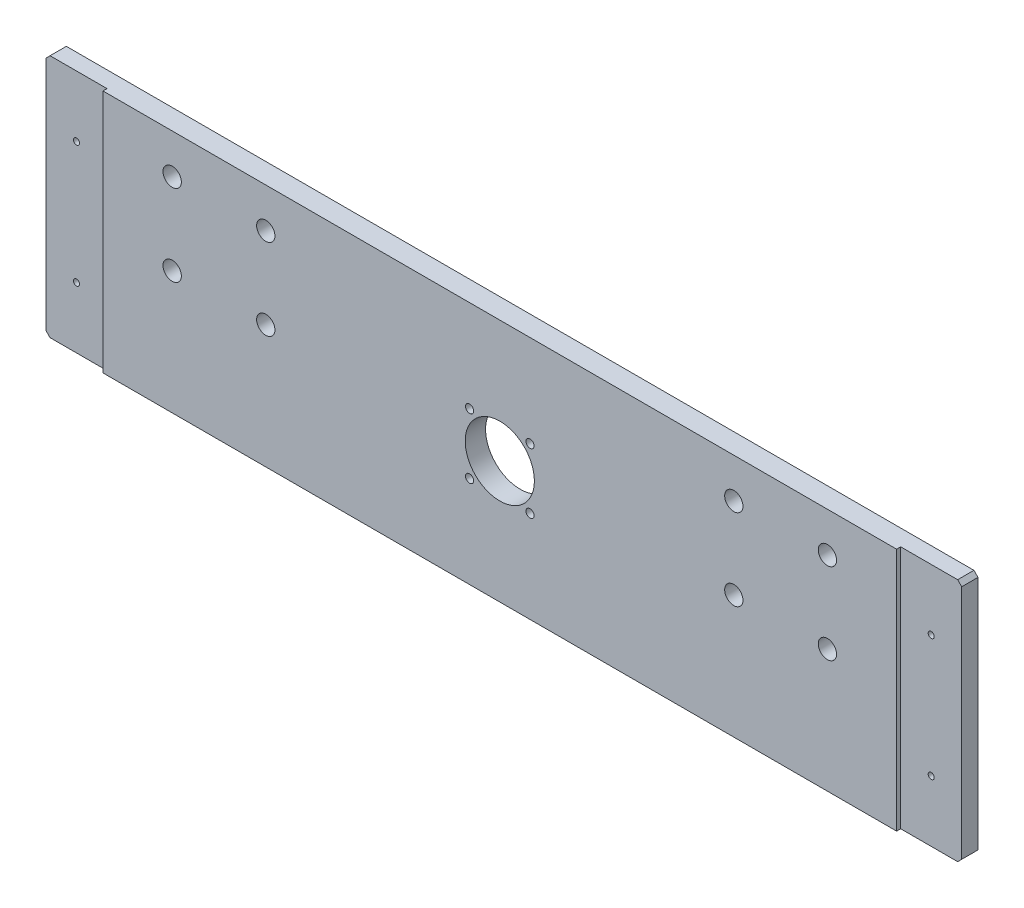
from build123d import *

# Parameters (mm, degrees)
SCHIZZO1_R                   = 17
SCHIZZO1_R_2                 = 2
SCHIZZO1_R_3                 = 4.5
SCHIZZO1_R_4                 = 1.5
ESTRUSIONE_ESTRUSIONE1_DEPTH = 10
SCHIZZO2_W                   = 30
SCHIZZO2_H                   = 120
TAGLIO_ESTRUSIONE1_DEPTH     = 2


with BuildPart() as part:
    # Schizzo1 → Estrusione-Estrusione1 (new body)
    with BuildSketch(Plane.XY):
        Polygon((2, 0), (448, 0), (450, 2), (450, 118), (448, 120), (2, 120), (0, 118), (0, 2), align=None)
        with Locations((225, 60)):
            Circle(SCHIZZO1_R, mode=Mode.SUBTRACT)
        with Locations((239.849242405, 74.849242405)):
            Circle(SCHIZZO1_R_2, mode=Mode.SUBTRACT)
        with Locations((386, 100.5)):
            Circle(SCHIZZO1_R_3, mode=Mode.SUBTRACT)
        with Locations((239.849242405, 45.150757595)):
            Circle(SCHIZZO1_R_2, mode=Mode.SUBTRACT)
        with Locations((210.150757595, 45.150757595)):
            Circle(SCHIZZO1_R_2, mode=Mode.SUBTRACT)
        with Locations((110, 100.5)):
            Circle(SCHIZZO1_R_3, mode=Mode.SUBTRACT)
        with Locations((110, 60.5)):
            Circle(SCHIZZO1_R_3, mode=Mode.SUBTRACT)
        with Locations((64, 60.5)):
            Circle(SCHIZZO1_R_3, mode=Mode.SUBTRACT)
        with Locations((64, 100.5)):
            Circle(SCHIZZO1_R_3, mode=Mode.SUBTRACT)
        with Locations((386, 60.5)):
            Circle(SCHIZZO1_R_3, mode=Mode.SUBTRACT)
        with Locations((15, 30)):
            Circle(SCHIZZO1_R_4, mode=Mode.SUBTRACT)
        with Locations((435, 30)):
            Circle(SCHIZZO1_R_4, mode=Mode.SUBTRACT)
        with Locations((210.150757595, 74.849242405)):
            Circle(SCHIZZO1_R_2, mode=Mode.SUBTRACT)
        with Locations((340, 60.5)):
            Circle(SCHIZZO1_R_3, mode=Mode.SUBTRACT)
        with Locations((340, 100.5)):
            Circle(SCHIZZO1_R_3, mode=Mode.SUBTRACT)
        with Locations((435, 90)):
            Circle(SCHIZZO1_R_4, mode=Mode.SUBTRACT)
        with Locations((15, 90)):
            Circle(SCHIZZO1_R_4, mode=Mode.SUBTRACT)
    extrude(amount=-ESTRUSIONE_ESTRUSIONE1_DEPTH)

    # Schizzo2 → Taglio-Estrusione1 (cut)
    with BuildSketch(Plane.XY):
        with Locations((15, 60)):
            Rectangle(SCHIZZO2_W, SCHIZZO2_H)
        with Locations((435, 60)):
            Rectangle(SCHIZZO2_W, SCHIZZO2_H)
    extrude(amount=-TAGLIO_ESTRUSIONE1_DEPTH, mode=Mode.SUBTRACT)


solid = part.part
